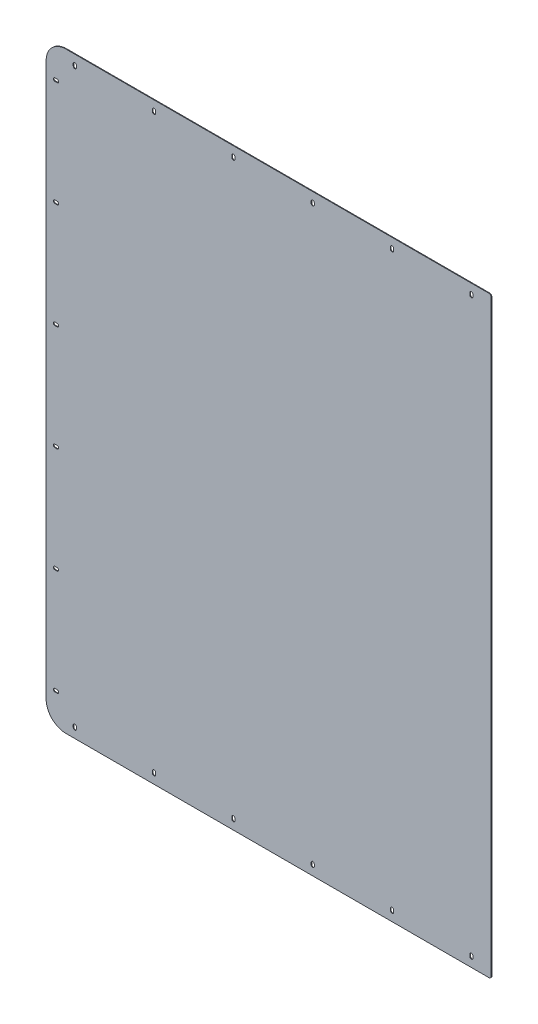
from build123d import *

# Parameters (mm, degrees)
SKETCH_1_W             = 1010
SKETCH_1_H             = 1345
SM_BASE_FLANGE_1_DEPTH = 1.5
FILLET_1_R             = 45
FILLET_2_R             = 5
CUT_EXTRUDE_1_DEPTH    = 10
PATTERN_LINEAR_1_COUNT = 6
PATTERN_LINEAR_1_PITCH = 240
CUT_EXTRUDE_2_DEPTH    = 10
PATTERN_LINEAR_2_COUNT = 6
PATTERN_LINEAR_2_PITCH = 180


# Sheet-metal steps are written as plain solids
with BuildPart() as part:
    # Sketch 1 → 基体-法兰1 (new body)
    with BuildSketch(Plane.XY):
        Rectangle(SKETCH_1_W, SKETCH_1_H)
    extrude(amount=-SM_BASE_FLANGE_1_DEPTH)

    # 圆角1
    fillet_1_edges = [part.edges().sort_by_distance(p)[0] for p in [
        (-505, 672.5, -0.75),
        (-505, -672.5, -0.75),
    ]]
    fillet(fillet_1_edges, radius=FILLET_1_R)

    # 圆角2
    fillet_2_edges = [part.edges().sort_by_distance(p)[0] for p in [
        (505, 672.5, -0.75),
        (505, -672.5, -0.75),
    ]]
    fillet(fillet_2_edges, radius=FILLET_2_R)

    # Sketch 2 → 切除-拉伸1 (cut)
    with BuildSketch(Plane.XY):
        with BuildLine():
            Line((-485, -596.5), (-480, -596.5))
            ThreePointArc((-480, -596.5), (-476.5, -600), (-480, -603.5))
            Line((-480, -603.5), (-485, -603.5))
            ThreePointArc((-485, -603.5), (-488.5, -600), (-485, -596.5))
        make_face()
    cut_extrude_1 = extrude(amount=-CUT_EXTRUDE_1_DEPTH, mode=Mode.SUBTRACT)

    # 阵列(线性)1: 切除-拉伸1 ×6
    with Locations(*[(0, i * PATTERN_LINEAR_1_PITCH, 0) for i in range(1, PATTERN_LINEAR_1_COUNT)]):
        add(cut_extrude_1, mode=Mode.SUBTRACT)

    # 草图3 → 切除-拉伸2 (cut)
    with BuildSketch(Plane.XY):
        with BuildLine():
            Line((-436.5, 652.5), (-436.5, 647.5))
            ThreePointArc((-436.5, 647.5), (-440, 644), (-443.5, 647.5))
            Line((-443.5, 647.5), (-443.5, 652.5))
            ThreePointArc((-443.5, 652.5), (-440, 656), (-436.5, 652.5))
        make_face()
        with BuildLine():
            Line((-436.5, -647.5), (-436.5, -652.5))
            ThreePointArc((-436.5, -652.5), (-440, -656), (-443.5, -652.5))
            Line((-443.5, -652.5), (-443.5, -647.5))
            ThreePointArc((-443.5, -647.5), (-440, -644), (-436.5, -647.5))
        make_face()
    cut_extrude_2 = extrude(amount=-CUT_EXTRUDE_2_DEPTH, mode=Mode.SUBTRACT)

    # 阵列(线性)2: 切除-拉伸2 ×6
    with Locations(*[(i * PATTERN_LINEAR_2_PITCH, 0, 0) for i in range(1, PATTERN_LINEAR_2_COUNT)]):
        add(cut_extrude_2, mode=Mode.SUBTRACT)


solid = part.part
